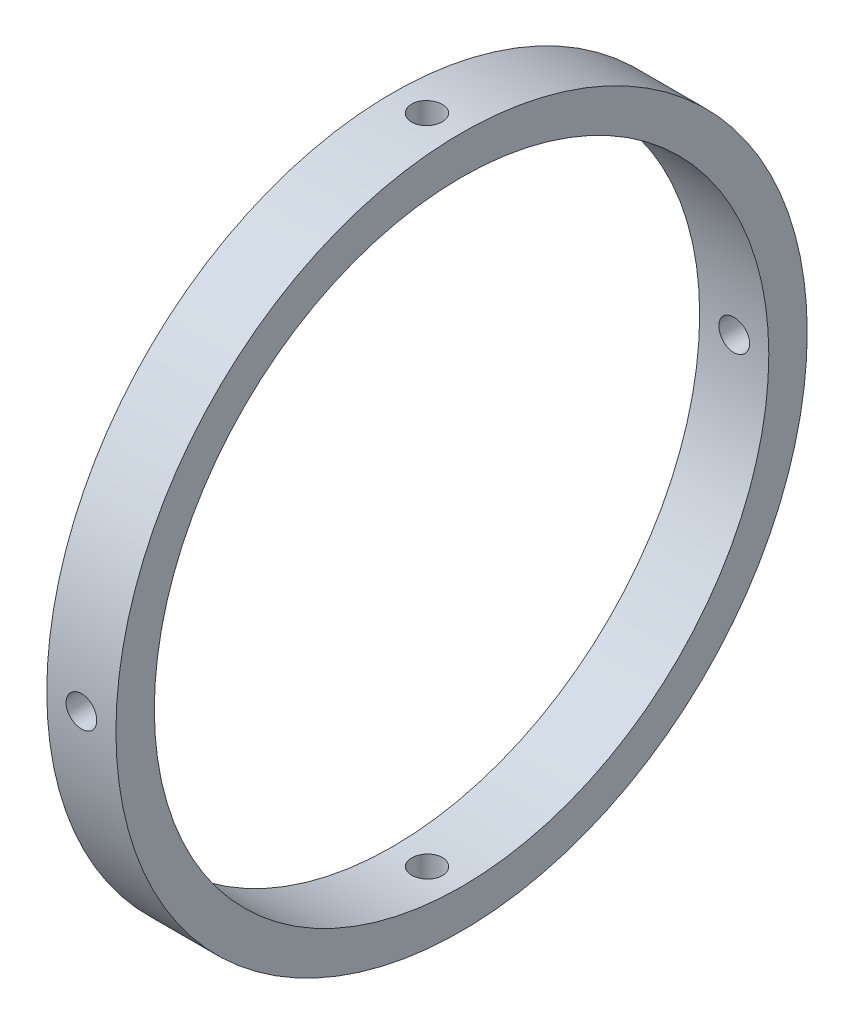
from build123d import *

# Parameters (mm, degrees)
RING_SKETCH_W          = 18
RING_SKETCH_H          = 10
BUSHING_BORE_SKETCH_W  = 4
BUSHING_BORE_SKETCH_H  = 12
BUSHING_BORES_X4_COUNT = 4


with BuildPart() as part:
    # Ring Sketch → Ring (revolve)
    with BuildSketch(Plane.XY):
        with Locations((-48, 85)):
            Rectangle(RING_SKETCH_W, RING_SKETCH_H)
    revolve(axis=Axis((-108, 0, 0), (1, 0, 0)))

    # Bushing Bore Sketch → Bushing Bore (revolve, cut)
    with BuildSketch(Plane.XY):
        with Locations((-46, 85)):
            Rectangle(BUSHING_BORE_SKETCH_W, BUSHING_BORE_SKETCH_H)
    bushing_bore = revolve(axis=Axis((-48, 70, 0), (0, 1, 0)), mode=Mode.SUBTRACT)

    # Bushing Bores x4: Bushing Bore ×4 about axis
    bushing_bores_x4_axis = Axis((-38.1, 0, 0), (-1, 0, 0))
    for i in range(1, BUSHING_BORES_X4_COUNT):
        add(bushing_bore.rotate(bushing_bores_x4_axis, i * 360 / BUSHING_BORES_X4_COUNT), mode=Mode.SUBTRACT)


solid = part.part
